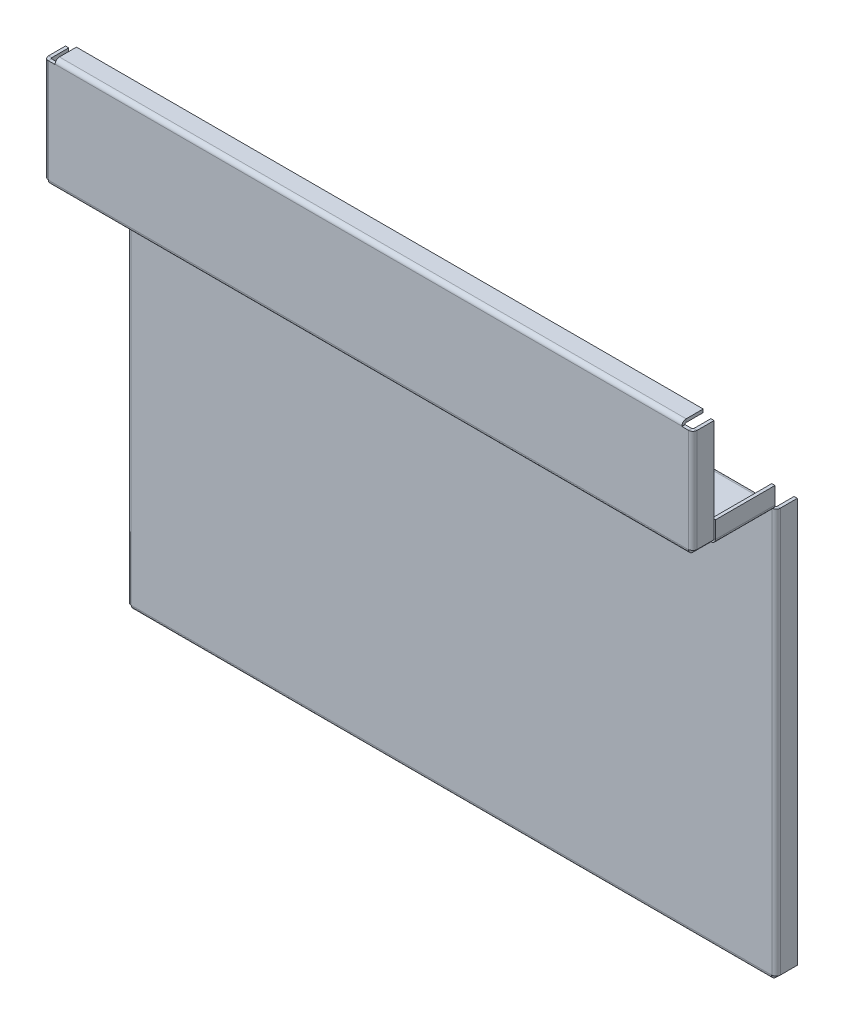
from build123d import *

# Parameters (mm, degrees)
SKETCH1_W                 = 629.92
SKETCH1_H                 = 101.6
BASE_FLANGE1_DEPTH        = 3.175
EDGE_FLANGE1_DEPTH        = 617.22
EDGE_FLANGE2_DEPTH        = 101.6
EDGE_FLANGE2_BEND_DEPTH   = 101.6
EDGE_FLANGE3_DEPTH        = 630.46
EDGE_FLANGE4_DEPTH        = 630.46
EDGE_FLANGE5_DEPTH        = 630.46
EDGE_FLANGE6_DEPTH        = 58.706
EDGE_FLANGE6_BEND_DEPTH   = 58.706
EDGE_FLANGE6_BEND_2_DEPTH = 398.304
EDGE_FLANGE6_BEND_3_DEPTH = 398.304


# Sheet-metal steps are written as plain solids
with BuildPart() as part:
    # Sketch1 → Base-Flange1 (new body)
    with BuildSketch(Plane.XY):
        Rectangle(SKETCH1_W, SKETCH1_H)
    extrude(amount=-BASE_FLANGE1_DEPTH)

    # Edge-Flange1 section (across the edge) → Edge-Flange1 (add)
    with BuildSketch(Plane(origin=(-308.61, 52.07, -3.175), x_dir=(0, -1, 0), z_dir=(1, 0, 0))):
        with BuildLine():
            Line((-3.175, 1), (-3.175, 17.78))
            Line((-3.175, 17.78), (0, 17.78))
            Line((0, 17.78), (0, 1))
            ThreePointArc((0, 1), (0.292893219, 0.292893219), (1, 0))
            Line((1, 0), (1.27, 0))
            Line((1.27, 0), (1.27, -3.175))
            Line((1.27, -3.175), (1, -3.175))
            ThreePointArc((1, -3.175), (-1.952170811, -1.952170811), (-3.175, 1))
        make_face()
    extrude(amount=EDGE_FLANGE1_DEPTH)

    # Edge-Flange2 section (across the edge) → Edge-Flange2 (add)
    with BuildSketch(Plane(origin=(-316.23, -50.8, -3.175), x_dir=(1, 0, 0), z_dir=(0, 1, 0))):
        with BuildLine():
            Line((-3.175, 1), (-3.175, 17.78))
            Line((-3.175, 17.78), (0, 17.78))
            Line((0, 17.78), (0, 1))
            ThreePointArc((0, 1), (0.292893219, 0.292893219), (1, 0))
            Line((1, 0), (1.27, 0))
            Line((1.27, 0), (1.27, -3.175))
            Line((1.27, -3.175), (1, -3.175))
            ThreePointArc((1, -3.175), (-1.952170811, -1.952170811), (-3.175, 1))
        make_face()
    extrude(amount=EDGE_FLANGE2_DEPTH)

    # Edge-Flange2 section 2 (across the edge) → Edge-Flange2 bend (add)
    with BuildSketch(Plane(origin=(316.23, 50.8, -3.175), x_dir=(-1, 0, 0), z_dir=(0, -1, 0))):
        with BuildLine():
            Line((-3.175, 1), (-3.175, 17.78))
            Line((-3.175, 17.78), (0, 17.78))
            Line((0, 17.78), (0, 1))
            ThreePointArc((0, 1), (0.292893219, 0.292893219), (1, 0))
            Line((1, 0), (1.27, 0))
            Line((1.27, 0), (1.27, -3.175))
            Line((1.27, -3.175), (1, -3.175))
            ThreePointArc((1, -3.175), (-1.952170811, -1.952170811), (-3.175, 1))
        make_face()
    extrude(amount=EDGE_FLANGE2_BEND_DEPTH)

    # Edge-Flange3 section (across the edge) → Edge-Flange3 (add)
    with BuildSketch(Plane(origin=(315.23, -52.07, -3.175), x_dir=(0, 1, 0), z_dir=(-1, 0, 0))):
        with BuildLine():
            Line((-3.175, 1), (-3.175, 77.216))
            Line((-3.175, 77.216), (0, 77.216))
            Line((0, 77.216), (0, 1))
            ThreePointArc((0, 1), (0.292893219, 0.292893219), (1, 0))
            Line((1, 0), (1.27, 0))
            Line((1.27, 0), (1.27, -3.175))
            Line((1.27, -3.175), (1, -3.175))
            ThreePointArc((1, -3.175), (-1.952170811, -1.952170811), (-3.175, 1))
        make_face()
    extrude(amount=EDGE_FLANGE3_DEPTH)

    # Edge-Flange4 section (across the edge) → Edge-Flange4 (add)
    with BuildSketch(Plane(origin=(-315.23, -55.245, -81.661), x_dir=(0, 0, 1), z_dir=(1, 0, 0))):
        with BuildLine():
            Line((-3.175, 1), (-3.175, 399.034))
            Line((-3.175, 399.034), (0, 399.034))
            Line((0, 399.034), (0, 1))
            ThreePointArc((0, 1), (0.292893219, 0.292893219), (1, 0))
            Line((1, 0), (1.27, 0))
            Line((1.27, 0), (1.27, -3.175))
            Line((1.27, -3.175), (1, -3.175))
            ThreePointArc((1, -3.175), (-1.952170811, -1.952170811), (-3.175, 1))
        make_face()
    extrude(amount=EDGE_FLANGE4_DEPTH)

    # Edge-Flange5 section (across the edge) → Edge-Flange5 (add)
    with BuildSketch(Plane(origin=(315.23, -455.549, -84.836), x_dir=(0, 1, 0), z_dir=(-1, 0, 0))):
        with BuildLine():
            Line((-3.175, 1), (-3.175, 17.78))
            Line((-3.175, 17.78), (0, 17.78))
            Line((0, 17.78), (0, 1))
            ThreePointArc((0, 1), (0.292893219, 0.292893219), (1, 0))
            Line((1, 0), (1.27, 0))
            Line((1.27, 0), (1.27, -3.175))
            Line((1.27, -3.175), (1, -3.175))
            ThreePointArc((1, -3.175), (-1.952170811, -1.952170811), (-3.175, 1))
        make_face()
    extrude(amount=EDGE_FLANGE5_DEPTH)

    # Edge-Flange6 section (across the edge) → Edge-Flange6 (add)
    with BuildSketch(Plane(origin=(-316.5, -52.07, -80.661), x_dir=(1, 0, 0), z_dir=(0, 0, 1))):
        with BuildLine():
            Line((-3.175, 1), (-3.175, 17.78))
            Line((-3.175, 17.78), (0, 17.78))
            Line((0, 17.78), (0, 1))
            ThreePointArc((0, 1), (0.292893219, 0.292893219), (1, 0))
            Line((1, 0), (1.27, 0))
            Line((1.27, 0), (1.27, -3.175))
            Line((1.27, -3.175), (1, -3.175))
            ThreePointArc((1, -3.175), (-1.952170811, -1.952170811), (-3.175, 1))
        make_face()
    extrude(amount=EDGE_FLANGE6_DEPTH)

    # Edge-Flange6 section 2 (across the edge) → Edge-Flange6 bend (add)
    with BuildSketch(Plane(origin=(316.5, -52.07, -21.955), x_dir=(-1, 0, 0), z_dir=(0, 0, -1))):
        with BuildLine():
            Line((-3.175, 1), (-3.175, 17.78))
            Line((-3.175, 17.78), (0, 17.78))
            Line((0, 17.78), (0, 1))
            ThreePointArc((0, 1), (0.292893219, 0.292893219), (1, 0))
            Line((1, 0), (1.27, 0))
            Line((1.27, 0), (1.27, -3.175))
            Line((1.27, -3.175), (1, -3.175))
            ThreePointArc((1, -3.175), (-1.952170811, -1.952170811), (-3.175, 1))
        make_face()
    extrude(amount=EDGE_FLANGE6_BEND_DEPTH)

    # Edge-Flange6 section 3 (across the edge) → Edge-Flange6 bend 2 (add)
    with BuildSketch(Plane(origin=(-316.5, -454.549, -84.836), x_dir=(1, 0, 0), z_dir=(0, 1, 0))):
        with BuildLine():
            Line((-3.175, 1), (-3.175, 17.78))
            Line((-3.175, 17.78), (0, 17.78))
            Line((0, 17.78), (0, 1))
            ThreePointArc((0, 1), (0.292893219, 0.292893219), (1, 0))
            Line((1, 0), (1.27, 0))
            Line((1.27, 0), (1.27, -3.175))
            Line((1.27, -3.175), (1, -3.175))
            ThreePointArc((1, -3.175), (-1.952170811, -1.952170811), (-3.175, 1))
        make_face()
    extrude(amount=EDGE_FLANGE6_BEND_2_DEPTH)

    # Edge-Flange6 section 4 (across the edge) → Edge-Flange6 bend 3 (add)
    with BuildSketch(Plane(origin=(316.5, -56.245, -84.836), x_dir=(-1, 0, 0), z_dir=(0, -1, 0))):
        with BuildLine():
            Line((-3.175, 1), (-3.175, 17.78))
            Line((-3.175, 17.78), (0, 17.78))
            Line((0, 17.78), (0, 1))
            ThreePointArc((0, 1), (0.292893219, 0.292893219), (1, 0))
            Line((1, 0), (1.27, 0))
            Line((1.27, 0), (1.27, -3.175))
            Line((1.27, -3.175), (1, -3.175))
            ThreePointArc((1, -3.175), (-1.952170811, -1.952170811), (-3.175, 1))
        make_face()
    extrude(amount=EDGE_FLANGE6_BEND_3_DEPTH)


solid = part.part
